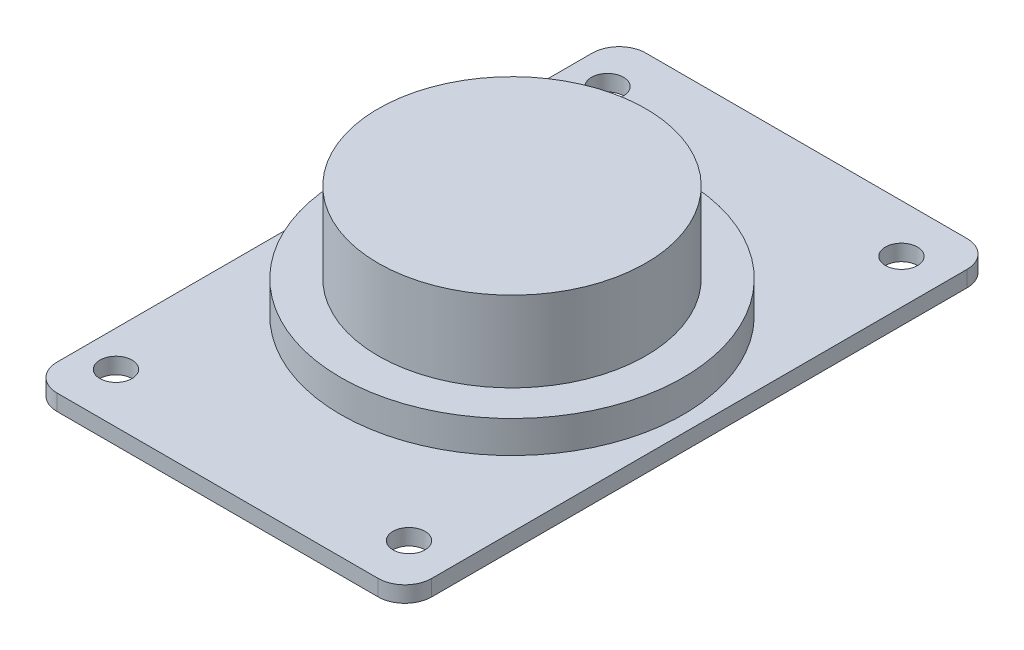
from build123d import *

# Parameters (mm, degrees)
SKETCH3_R           = 25
BOSS_EXTRUDE1_DEPTH = 15
SKETCH4_R           = 32
BOSS_EXTRUDE2_DEPTH = 6
BOSS_EXTRUDE3_DEPTH = 3
FILLET1_R           = 5
FILLET2_R           = 5
SKETCH8_R           = 3
CUT_EXTRUDE1_DEPTH  = 3


with BuildPart() as part:
    # Sketch3 → Boss-Extrude1 (new body)
    with BuildSketch(Plane(origin=(0, 0, 0), x_dir=(1, 0, 0), z_dir=(0, 1, 0))):
        Circle(SKETCH3_R)
    extrude(amount=-BOSS_EXTRUDE1_DEPTH)

    # Sketch4 → Boss-Extrude2 (add)
    with BuildSketch(Plane.XZ.offset(15)):
        Circle(SKETCH4_R)
    extrude(amount=BOSS_EXTRUDE2_DEPTH)

    # Sketch6 → Boss-Extrude3 (add)
    with BuildSketch(Plane.XZ.offset(21)):
        Polygon((35, 0), (35, -55), (-35, -55), (-35, 55), (35, 55), align=None)
    extrude(amount=BOSS_EXTRUDE3_DEPTH)

    # Fillet1
    fillet1_edges = [part.edges().sort_by_distance(p)[0] for p in [
        (35, -22.5, 55),
    ]]
    fillet(fillet1_edges, radius=FILLET1_R)

    # Fillet2
    fillet2_edges = [part.edges().sort_by_distance(p)[0] for p in [
        (-35, -22.5, 55),
        (-35, -22.5, -55),
        (35, -22.5, -55),
    ]]
    fillet(fillet2_edges, radius=FILLET2_R)

    # Sketch8 → Cut-Extrude1 (cut)
    with BuildSketch(Plane.XZ.offset(24)):
        with Locations((26.758523595, -46)):
            Circle(SKETCH8_R)
        with Locations((-28.158970904, -46)):
            Circle(SKETCH8_R)
        with Locations((26.758523595, 46)):
            Circle(SKETCH8_R)
        with Locations((-28.320886722, 45.663145403)):
            Circle(SKETCH8_R)
    extrude(amount=-CUT_EXTRUDE1_DEPTH, mode=Mode.SUBTRACT)


solid = part.part
